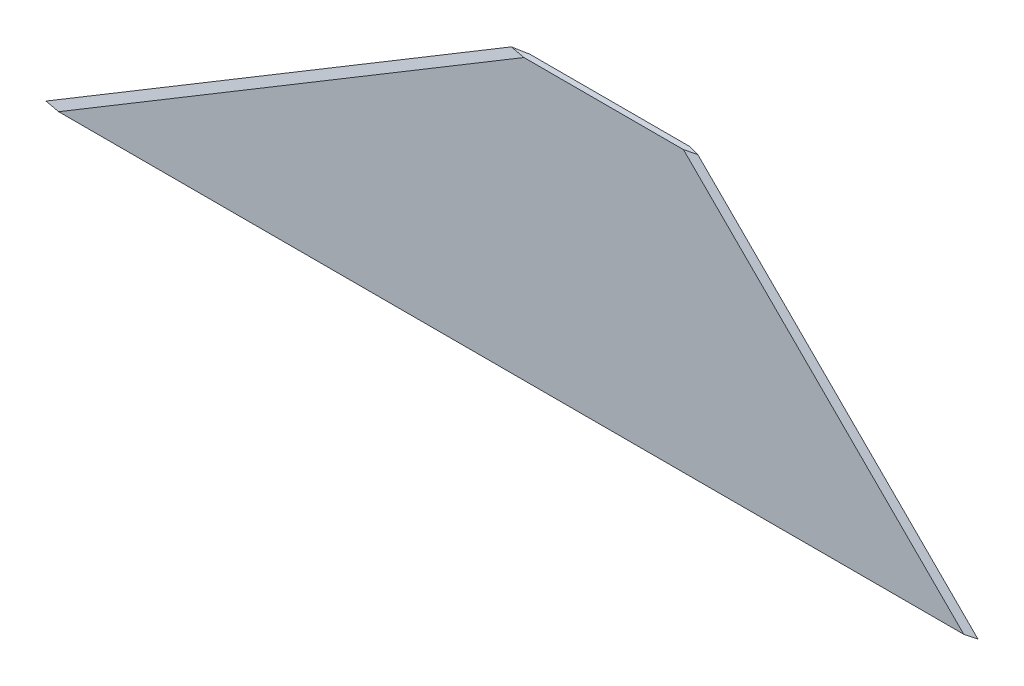
from build123d import *
from OCP.BRepFilletAPI import BRepFilletAPI_MakeChamfer

# Parameters (mm, degrees)
BOSS_EXTRUDE4_DEPTH = 3.175
CHAMFER1_SIZE       = 1.5875
CHAMFER1_SIZE2      = 4.361620403
CHAMFER2_SIZE       = 4.361620403
CHAMFER2_SIZE_2     = 1.5875


with BuildPart() as part:
    # Sketch1 → Boss-Extrude4 (new body)
    with BuildSketch(Plane.XY):
        Polygon((-508, 0), (0, 0), (-152.76380689, 152.4), (-254.36380689, 152.4), align=None)
    extrude(amount=BOSS_EXTRUDE4_DEPTH)

    # Chamfer1: one chamfer whose edges measure the first distance from different faces: ONE call of the kernel's chamfer builder (chamfer() names one face for all edges)
    chamfer1_edges_1 = [part.edges().sort_by_distance(p)[0] for p in [
        (-76.381903445, 76.2, 0),
    ]]
    chamfer1_side_1 = [part.faces().sort_by_distance(p)[0] for p in [
        (-76.381903445, 76.2, 1.5875),
    ]]
    chamfer1_edges_2 = [part.edges().sort_by_distance(p)[0] for p in [
        (-381.181903445, 76.2, 0),
    ]]
    chamfer1_side_2 = [part.faces().sort_by_distance(p)[0] for p in [
        (-381.181903445, 76.2, 1.5875),
    ]]
    chamfer1 = BRepFilletAPI_MakeChamfer(part.part.solid().wrapped)
    for e in chamfer1_edges_1:
        chamfer1.Add(CHAMFER1_SIZE, CHAMFER1_SIZE2, e.wrapped, chamfer1_side_1[0].wrapped)  # the first distance lies on this face
    for e in chamfer1_edges_2:
        chamfer1.Add(CHAMFER1_SIZE, CHAMFER1_SIZE2, e.wrapped, chamfer1_side_2[0].wrapped)  # the first distance lies on this face
    add(Compound.cast(chamfer1.Shape()), mode=Mode.REPLACE)

    # Chamfer2
    chamfer2_edges_1 = [part.edges().sort_by_distance(p)[0] for p in [
        (-76.381903445, 76.2, 3.175),
    ]]
    chamfer2_side_1 = [part.faces().sort_by_distance(p)[0] for p in [
        (-76.404327304, 76.177522611, 3.175),
    ]]
    chamfer2_edges_2 = [part.edges().sort_by_distance(p)[0] for p in [
        (-381.181903445, 76.2, 3.175),
    ]]
    chamfer2_side_2 = [part.faces().sort_by_distance(p)[0] for p in [
        (-381.181903445, 76.2, 3.14325),
    ]]
    chamfer2 = BRepFilletAPI_MakeChamfer(part.part.solid().wrapped)
    for e in chamfer2_edges_1:
        chamfer2.Add(CHAMFER2_SIZE - 0.0001, CHAMFER2_SIZE_2 - 0.0001, e.wrapped, chamfer2_side_1[0].wrapped)
    for e in chamfer2_edges_2:
        chamfer2.Add(CHAMFER2_SIZE_2 - 0.0001, CHAMFER2_SIZE - 0.0001, e.wrapped, chamfer2_side_2[0].wrapped)
    add(Compound.cast(chamfer2.Shape()), mode=Mode.REPLACE)  # a hair under: the kernel refuses the full size


solid = part.part
